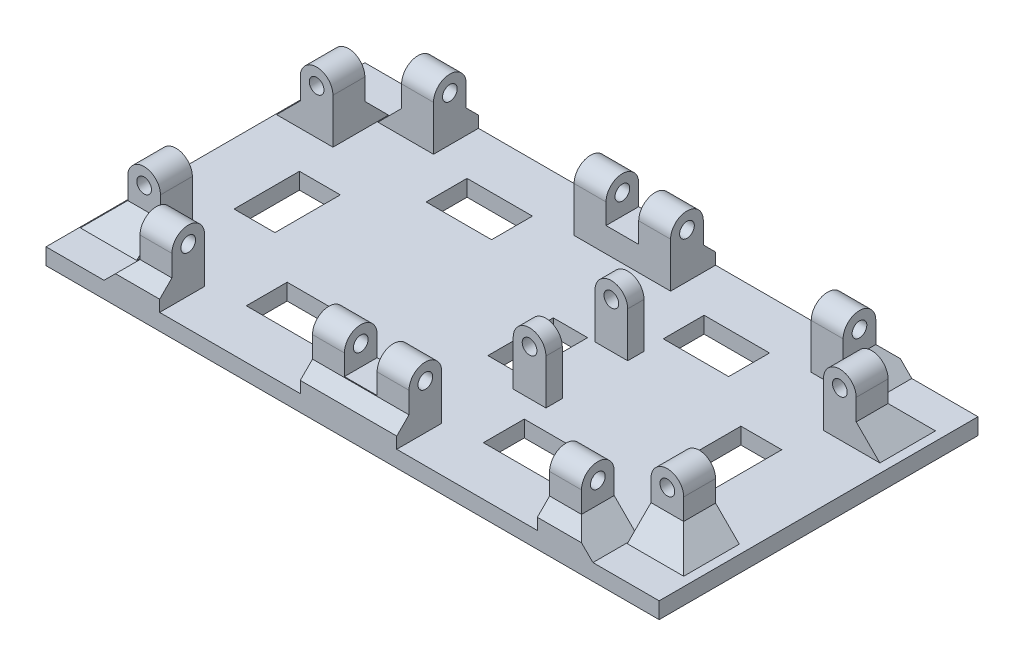
from build123d import *

# Parameters (mm, degrees)
SKETCH2_W                = 75
SKETCH2_H                = 39
BOSS_EXTRUDE1_DEPTH      = 2
BOSS_EXTRUDE2_START      = -10
SKETCH3_R                = 0.9
BOSS_EXTRUDE2_DEPTH      = 25
BOSS_EXTRUDE4_START      = -39
SKETCH3_2_R              = 0.9
BOSS_EXTRUDE4_DEPTH      = 25
BOSS_EXTRUDE5_DEPTH      = 12.5
BOSS_EXTRUDE5_DEPTH_BACK = 12.5
SKETCH7_R                = 0.9
SKETCH4_W                = 17.2
SKETCH4_H                = 7.5
CUT_EXTRUDE1_DEPTH       = 54.87717513
CUT_EXTRUDE2_REACH       = 44.927
SKETCH5_W                = 8
SKETCH5_H                = 5
SKETCH5_W_2              = 5
SKETCH5_H_2              = 8
SKETCH8_W                = 17.2
SKETCH8_H                = 7.5
CUT_EXTRUDE3_DEPTH       = 76.196409489
BOSS_EXTRUDE6_DEPTH      = 6
BOSS_EXTRUDE6_DEPTH_BACK = 6
SKETCH9_R                = 0.9
CUT_EXTRUDE4_REACH       = 54.355
SKETCH10_W               = 8
SKETCH10_H               = 7.5
CUT_EXTRUDE5_REACH       = 44.927
SKETCH11_W               = 4.2
SKETCH11_H               = 8
SKETCH12_W               = 4
SKETCH12_H               = 4
BOSS_EXTRUDE7_DEPTH      = 3
CHAMFER1_SIZE            = 2.9


with BuildPart() as part:
    # Sketch2 → Boss-Extrude1 (new body)
    with BuildSketch(Plane(origin=(0, 0, 0), x_dir=(1, 0, 0), z_dir=(0, 1, 0))):
        Rectangle(SKETCH2_W, SKETCH2_H)
    extrude(amount=BOSS_EXTRUDE1_DEPTH)

    # Sketch3 → Boss-Extrude2 (add)
    # profile 1 of 2: a face of its own
    with BuildSketch(Plane.ZY.offset(37.5).offset(BOSS_EXTRUDE2_START)):
        with BuildLine():
            Line((-18, 2), (-14, 2))
            Line((-14, 2), (-14, 7.5))
            ThreePointArc((-14, 7.5), (-16, 9.5), (-18, 7.5))
            Line((-18, 7.5), (-18, 2))
        make_face()
        with Locations((-16, 7.5)):
            Circle(SKETCH3_R, mode=Mode.SUBTRACT)
    # profile 2 of 2: a face of its own
    with BuildSketch(Plane.ZY.offset(37.5).offset(BOSS_EXTRUDE2_START)):
        with BuildLine():
            Line((18, 2), (18, 7.5))
            ThreePointArc((18, 7.5), (16, 9.5), (14, 7.5))
            Line((14, 7.5), (14, 2))
            Line((14, 2), (18, 2))
        make_face()
        with Locations((16, 7.5)):
            Circle(SKETCH3_R, mode=Mode.SUBTRACT)
    extrude(amount=-BOSS_EXTRUDE2_DEPTH)

    # Sketch3<2> → Boss-Extrude4 (add)
    # profile 1 of 2: a face of its own
    with BuildSketch(Plane.ZY.offset(37.5).offset(BOSS_EXTRUDE4_START)):
        with BuildLine():
            Line((-18, 2), (-14, 2))
            Line((-14, 2), (-14, 7.5))
            ThreePointArc((-14, 7.5), (-16, 9.5), (-18, 7.5))
            Line((-18, 7.5), (-18, 2))
        make_face()
        with Locations((-16, 7.5)):
            Circle(SKETCH3_2_R, mode=Mode.SUBTRACT)
    # profile 2 of 2: a face of its own
    with BuildSketch(Plane.ZY.offset(37.5).offset(BOSS_EXTRUDE4_START)):
        with BuildLine():
            Line((18, 2), (18, 7.5))
            ThreePointArc((18, 7.5), (16, 9.5), (14, 7.5))
            Line((14, 7.5), (14, 2))
            Line((14, 2), (18, 2))
        make_face()
        with Locations((16, 7.5)):
            Circle(SKETCH3_2_R, mode=Mode.SUBTRACT)
    extrude(amount=-BOSS_EXTRUDE4_DEPTH)

    # Sketch7 → Boss-Extrude5 (add, two sides: drawn at the far end of the back side and taken through both)
    # profile 1 of 2: a face of its own
    with BuildSketch(Plane.XY.offset(-BOSS_EXTRUDE5_DEPTH_BACK)):
        with BuildLine():
            Line((-34.5, 2), (-30.5, 2))
            Line((-30.5, 2), (-30.5, 7.5))
            ThreePointArc((-30.5, 7.5), (-32.5, 9.5), (-34.5, 7.5))
            Line((-34.5, 7.5), (-34.5, 2))
        make_face()
        with Locations((-32.5, 7.5)):
            Circle(SKETCH7_R, mode=Mode.SUBTRACT)
    # profile 2 of 2: a face of its own
    with BuildSketch(Plane.XY.offset(-BOSS_EXTRUDE5_DEPTH_BACK)):
        with BuildLine():
            Line((33.5, 2), (33.5, 7.5))
            ThreePointArc((33.5, 7.5), (31.5, 9.5), (29.5, 7.5))
            Line((29.5, 7.5), (29.5, 2))
            Line((29.5, 2), (33.5, 2))
        make_face()
        with Locations((31.5, 7.5)):
            Circle(SKETCH7_R, mode=Mode.SUBTRACT)
    extrude(amount=BOSS_EXTRUDE5_DEPTH + BOSS_EXTRUDE5_DEPTH_BACK)

    # Sketch4 → Cut-Extrude1 (cut, through all)
    with BuildSketch(Plane(origin=(0, 0, -18), x_dir=(-1, 0, 0), z_dir=(0, 0, -1))):
        with Locations((15, 5.75)):
            Rectangle(SKETCH4_W, SKETCH4_H)
        with Locations((-14, 5.75)):
            Rectangle(SKETCH4_W, SKETCH4_H)
    extrude(amount=-CUT_EXTRUDE1_DEPTH, mode=Mode.SUBTRACT)

    # Sketch5 → Cut-Extrude2 (cut, up to next)
    with BuildSketch(Plane(origin=(0, 2, 0), x_dir=(1, 0, 0), z_dir=(0, 1, 0)), mode=Mode.PRIVATE) as cut_extrude2_sk1:
        with Locations((-15, 11)):
            Rectangle(SKETCH5_W, SKETCH5_H)
    cut_extrude2_tool1 = extrude(cut_extrude2_sk1.sketch, amount=-CUT_EXTRUDE2_REACH, mode=Mode.PRIVATE) & part.part
    # Sketch5 → Cut-Extrude2 (cut, up to next)
    with BuildSketch(Plane(origin=(0, 2, 0), x_dir=(1, 0, 0), z_dir=(0, 1, 0)), mode=Mode.PRIVATE) as cut_extrude2_sk2:
        with Locations((14, 11)):
            Rectangle(SKETCH5_W, SKETCH5_H)
    cut_extrude2_tool2 = extrude(cut_extrude2_sk2.sketch, amount=-CUT_EXTRUDE2_REACH, mode=Mode.PRIVATE) & part.part
    # Sketch5 → Cut-Extrude2 (cut, up to next)
    with BuildSketch(Plane(origin=(0, 2, 0), x_dir=(1, 0, 0), z_dir=(0, 1, 0)), mode=Mode.PRIVATE) as cut_extrude2_sk3:
        with Locations((-15, -11)):
            Rectangle(SKETCH5_W, SKETCH5_H)
    cut_extrude2_tool3 = extrude(cut_extrude2_sk3.sketch, amount=-CUT_EXTRUDE2_REACH, mode=Mode.PRIVATE) & part.part
    # Sketch5 → Cut-Extrude2 (cut, up to next)
    with BuildSketch(Plane(origin=(0, 2, 0), x_dir=(1, 0, 0), z_dir=(0, 1, 0)), mode=Mode.PRIVATE) as cut_extrude2_sk4:
        with Locations((14, -11)):
            Rectangle(SKETCH5_W, SKETCH5_H)
    cut_extrude2_tool4 = extrude(cut_extrude2_sk4.sketch, amount=-CUT_EXTRUDE2_REACH, mode=Mode.PRIVATE) & part.part
    # Sketch5 → Cut-Extrude2 (cut, up to next)
    with BuildSketch(Plane(origin=(0, 2, 0), x_dir=(1, 0, 0), z_dir=(0, 1, 0)), mode=Mode.PRIVATE) as cut_extrude2_sk5:
        with Locations((26.5, 0)):
            Rectangle(SKETCH5_W_2, SKETCH5_H_2)
    cut_extrude2_tool5 = extrude(cut_extrude2_sk5.sketch, amount=-CUT_EXTRUDE2_REACH, mode=Mode.PRIVATE) & part.part
    # Sketch5 → Cut-Extrude2 (cut, up to next)
    with BuildSketch(Plane(origin=(0, 2, 0), x_dir=(1, 0, 0), z_dir=(0, 1, 0)), mode=Mode.PRIVATE) as cut_extrude2_sk6:
        with Locations((-27.5, 0)):
            Rectangle(SKETCH5_W_2, SKETCH5_H_2)
    cut_extrude2_tool6 = extrude(cut_extrude2_sk6.sketch, amount=-CUT_EXTRUDE2_REACH, mode=Mode.PRIVATE) & part.part
    add(cut_extrude2_tool1.solids().sort_by_distance((-15, 2, -11))[0], mode=Mode.SUBTRACT)
    add(cut_extrude2_tool2.solids().sort_by_distance((14, 2, -11))[0], mode=Mode.SUBTRACT)
    add(cut_extrude2_tool3.solids().sort_by_distance((-15, 2, 11))[0], mode=Mode.SUBTRACT)
    add(cut_extrude2_tool4.solids().sort_by_distance((14, 2, 11))[0], mode=Mode.SUBTRACT)
    add(cut_extrude2_tool5.solids().sort_by_distance((26.5, 2, 0))[0], mode=Mode.SUBTRACT)
    add(cut_extrude2_tool6.solids().sort_by_distance((-27.5, 2, 0))[0], mode=Mode.SUBTRACT)

    # Sketch8 → Cut-Extrude3 (cut, through all)
    with BuildSketch(Plane.ZY.offset(34.5)):
        with Locations((0, 5.75)):
            Rectangle(SKETCH8_W, SKETCH8_H)
    extrude(amount=-CUT_EXTRUDE3_DEPTH, mode=Mode.SUBTRACT)

    # Sketch9 → Boss-Extrude6 (add, two sides: drawn at the far end of the back side and taken through both)
    with BuildSketch(Plane.XY.offset(-BOSS_EXTRUDE6_DEPTH_BACK)):
        with BuildLine():
            Line((10.15, 2), (10.15, 7.5))
            ThreePointArc((10.15, 7.5), (8.15, 9.5), (6.15, 7.5))
            Line((6.15, 7.5), (6.15, 2))
            Line((6.15, 2), (10.15, 2))
        make_face()
        with Locations((8.15, 7.5)):
            Circle(SKETCH9_R, mode=Mode.SUBTRACT)
    extrude(amount=BOSS_EXTRUDE6_DEPTH + BOSS_EXTRUDE6_DEPTH_BACK)

    # Sketch10 → Cut-Extrude4 (cut, up to next)
    with BuildSketch(Plane(origin=(10.15, 0, 0), x_dir=(0, 0, -1), z_dir=(1, 0, 0)), mode=Mode.PRIVATE) as cut_extrude4_sk1:
        with Locations((0, 5.75)):
            Rectangle(SKETCH10_W, SKETCH10_H)
    cut_extrude4_tool1 = extrude(cut_extrude4_sk1.sketch, amount=-CUT_EXTRUDE4_REACH, mode=Mode.PRIVATE) & part.part
    add(cut_extrude4_tool1.solids().sort_by_distance((10.15, 5.75, 0))[0], mode=Mode.SUBTRACT)

    # Sketch11 → Cut-Extrude5 (cut, up to next)
    with BuildSketch(Plane(origin=(0, 2, 0), x_dir=(1, 0, 0), z_dir=(0, 1, 0)), mode=Mode.PRIVATE) as cut_extrude5_sk1:
        with Locations((3.15, 0)):
            Rectangle(SKETCH11_W, SKETCH11_H)
    cut_extrude5_tool1 = extrude(cut_extrude5_sk1.sketch, amount=-CUT_EXTRUDE5_REACH, mode=Mode.PRIVATE) & part.part
    add(cut_extrude5_tool1.solids().sort_by_distance((3.15, 2, 0))[0], mode=Mode.SUBTRACT)

    # Sketch12 → Boss-Extrude7 (add)
    with BuildSketch(Plane(origin=(0, 2, 0), x_dir=(1, 0, 0), z_dir=(0, 1, 0))):
        with Locations((-0.5, -16)):
            Rectangle(SKETCH12_W, SKETCH12_H)
        with Locations((-0.5, 16)):
            Rectangle(SKETCH12_W, SKETCH12_H)
    extrude(amount=BOSS_EXTRUDE7_DEPTH)

    # Chamfer1
    # the kernel refuses this chamfer: 2.9 mm, written as the material it adds along each edge
    with BuildSketch(Plane(origin=(-27.5, 2, 18), x_dir=(0, -0.027495876610586396, 0.9996219169112968), z_dir=(1, 0, 0))) as chamfer1_piece_1_section:
        Polygon((CHAMFER1_SIZE * 0.999621916911, -CHAMFER1_SIZE * 0.0274958766106), (-CHAMFER1_SIZE * 0.0274958766106, -CHAMFER1_SIZE * 0.999621916911), (0, 0), align=None)
    chamfer1_piece_1 = extrude(amount=3.9, mode=Mode.PRIVATE)
    chamfer1_piece_1 = split(chamfer1_piece_1, bisect_by=Plane(origin=(-25.55, 3.131220623, 19.5), z_dir=(0, 0, -1)), keep=Keep.TOP, mode=Mode.PRIVATE)
    add(chamfer1_piece_1)
    with BuildSketch(Plane(origin=(-27.5, 2, -18), x_dir=(0, -0.027495876610586546, -0.9996219169112968), z_dir=(1, 0, 0))) as chamfer1_piece_2_section:
        Polygon((CHAMFER1_SIZE * 0.999621916911, CHAMFER1_SIZE * 0.0274958766106), (-CHAMFER1_SIZE * 0.0274958766106, CHAMFER1_SIZE * 0.999621916911), (0, 0), align=None)
    chamfer1_piece_2 = extrude(amount=3.9, mode=Mode.PRIVATE)
    chamfer1_piece_2 = split(chamfer1_piece_2, bisect_by=Plane(origin=(-25.55, 3.131220623, -19.5), z_dir=(0, 0, 1)), keep=Keep.TOP, mode=Mode.PRIVATE)
    add(chamfer1_piece_2)
    with BuildSketch(Plane(origin=(-6.4, 2, -18), x_dir=(0, -0.02749587661058513, -0.9996219169112968), z_dir=(1, 0, 0))) as chamfer1_piece_3_section:
        Polygon((CHAMFER1_SIZE * 0.999621916911, CHAMFER1_SIZE * 0.0274958766106), (-CHAMFER1_SIZE * 0.0274958766106, CHAMFER1_SIZE * 0.999621916911), (0, 0), align=None)
    chamfer1_piece_3 = extrude(amount=11.8, mode=Mode.PRIVATE)
    chamfer1_piece_3 = split(chamfer1_piece_3, bisect_by=Plane(origin=(-0.5, 3.131220623, -19.5), z_dir=(0, 0, 1)), keep=Keep.TOP, mode=Mode.PRIVATE)
    add(chamfer1_piece_3)
    with BuildSketch(Plane(origin=(-27.5, 2, -18), x_dir=(-0.9996219169112968, -0.027495876610586546, 0), z_dir=(0, 0, 1)), Plane(origin=(-27.5, 2, 14), x_dir=(-0.9996219169112968, -0.027495876610586396, 0), z_dir=(0, 0, 1)), Plane(origin=(-34.5, 2, 12.5), x_dir=(0, -0.02749587661058638, 0.9996219169112968), z_dir=(1, 0, 0)), Plane(origin=(29.5, 2, 12.5), x_dir=(0, -0.02749587661058638, 0.9996219169112968), z_dir=(1, 0, 0))) as chamfer1_piece_4:
        Polygon((CHAMFER1_SIZE * 0.999621916911, -CHAMFER1_SIZE * 0.0274958766106), (-CHAMFER1_SIZE * 0.0274958766106, -CHAMFER1_SIZE * 0.999621916911), (0, 0), align=None)
    extrude(amount=4)
    with BuildSketch(Plane(origin=(33.5, 2, 8.6), x_dir=(0.9996219169112968, -0.027495876610586396, 0), z_dir=(0, 0, 1)), Plane(origin=(33.5, 2, -12.5), x_dir=(0.9996219169112968, -0.027495876610586396, 0), z_dir=(0, 0, 1))) as chamfer1_piece_5:
        Polygon((CHAMFER1_SIZE * 0.999621916911, CHAMFER1_SIZE * 0.0274958766106), (-CHAMFER1_SIZE * 0.0274958766106, CHAMFER1_SIZE * 0.999621916911), (0, 0), align=None)
    extrude(amount=3.9)
    with BuildSketch(Plane(origin=(5.4, 2, 18), x_dir=(0, -0.027495876610586396, 0.9996219169112968), z_dir=(-1, 0, 0))) as chamfer1_piece_6_section:
        Polygon((CHAMFER1_SIZE * 0.999621916911, CHAMFER1_SIZE * 0.0274958766106), (-CHAMFER1_SIZE * 0.0274958766106, CHAMFER1_SIZE * 0.999621916911), (0, 0), align=None)
    chamfer1_piece_6 = extrude(amount=11.8, mode=Mode.PRIVATE)
    chamfer1_piece_6 = split(chamfer1_piece_6, bisect_by=Plane(origin=(-0.5, 3.131220623, 19.5), z_dir=(0, 0, -1)), keep=Keep.TOP, mode=Mode.PRIVATE)
    add(chamfer1_piece_6)
    with BuildSketch(Plane(origin=(-34.5, 2, 8.6), x_dir=(-0.9996219169112968, -0.027495876610586396, 0), z_dir=(0, 0, 1)), Plane(origin=(-34.5, 2, -12.5), x_dir=(-0.9996219169112968, -0.027495876610586396, 0), z_dir=(0, 0, 1))) as chamfer1_piece_7:
        Polygon((CHAMFER1_SIZE * 0.999621916911, -CHAMFER1_SIZE * 0.0274958766106), (-CHAMFER1_SIZE * 0.0274958766106, -CHAMFER1_SIZE * 0.999621916911), (0, 0), align=None)
    extrude(amount=3.9)
    with BuildSketch(Plane(origin=(22.6, 2, -18), x_dir=(0, -0.027495876610586546, -0.9996219169112968), z_dir=(1, 0, 0))) as chamfer1_piece_8_section:
        Polygon((CHAMFER1_SIZE * 0.999621916911, CHAMFER1_SIZE * 0.0274958766106), (-CHAMFER1_SIZE * 0.0274958766106, CHAMFER1_SIZE * 0.999621916911), (0, 0), align=None)
    chamfer1_piece_8 = extrude(amount=3.9, mode=Mode.PRIVATE)
    chamfer1_piece_8 = split(chamfer1_piece_8, bisect_by=Plane(origin=(24.55, 3.131220623, -19.5), z_dir=(0, 0, 1)), keep=Keep.TOP, mode=Mode.PRIVATE)
    add(chamfer1_piece_8)
    with BuildSketch(Plane(origin=(26.5, 2, -18), x_dir=(0.9996219169112968, -0.027495876610586546, 0), z_dir=(0, 0, 1)), Plane(origin=(26.5, 2, 14), x_dir=(0.9996219169112968, -0.027495876610586396, 0), z_dir=(0, 0, 1)), Plane(origin=(-34.5, 2, -12.5), x_dir=(0, -0.02749587661058638, -0.9996219169112968), z_dir=(1, 0, 0)), Plane(origin=(29.5, 2, -12.5), x_dir=(0, -0.02749587661058638, -0.9996219169112968), z_dir=(1, 0, 0))) as chamfer1_piece_9:
        Polygon((CHAMFER1_SIZE * 0.999621916911, CHAMFER1_SIZE * 0.0274958766106), (-CHAMFER1_SIZE * 0.0274958766106, CHAMFER1_SIZE * 0.999621916911), (0, 0), align=None)
    extrude(amount=4)
    with BuildSketch(Plane(origin=(22.6, 2, 18), x_dir=(0, -0.027495876610586396, 0.9996219169112968), z_dir=(1, 0, 0))) as chamfer1_piece_10_section:
        Polygon((CHAMFER1_SIZE * 0.999621916911, -CHAMFER1_SIZE * 0.0274958766106), (-CHAMFER1_SIZE * 0.0274958766106, -CHAMFER1_SIZE * 0.999621916911), (0, 0), align=None)
    chamfer1_piece_10 = extrude(amount=3.9, mode=Mode.PRIVATE)
    chamfer1_piece_10 = split(chamfer1_piece_10, bisect_by=Plane(origin=(24.55, 3.131220623, 19.5), z_dir=(0, 0, -1)), keep=Keep.TOP, mode=Mode.PRIVATE)
    add(chamfer1_piece_10)
    with BuildSketch(Plane(origin=(-34.957880665, 2, 18), x_dir=(0, -0.027495876610586396, 0.9996219169112968), z_dir=(1, 0, 0))) as chamfer1_piece_11a_section:
        Polygon((CHAMFER1_SIZE * 0.999621916911, -CHAMFER1_SIZE * 0.0274958766106), (-CHAMFER1_SIZE * 0.0274958766106, -CHAMFER1_SIZE * 0.999621916911), (0, 0), align=None)
    chamfer1_piece_11a = extrude(amount=11.357880665, mode=Mode.PRIVATE)
    chamfer1_piece_11a = split(chamfer1_piece_11a, bisect_by=Plane(origin=(-31.228940333, 3.131220623, 19.5), z_dir=(0, 0, -1)), keep=Keep.TOP, mode=Mode.PRIVATE)
    chamfer1_piece_11a = split(chamfer1_piece_11a, bisect_by=Plane(origin=(-27.5, 3.131220623, 18.622253748), z_dir=(-1, 0, 0)), keep=Keep.TOP, mode=Mode.PRIVATE)
    with BuildSketch(Plane(origin=(-27.5, 2, 14), x_dir=(-0.9996219169112968, -0.027495876610586396, 0), z_dir=(0, 0, 1))) as chamfer1_piece_11b_section:
        Polygon((CHAMFER1_SIZE * 0.999621916911, -CHAMFER1_SIZE * 0.0274958766106), (-CHAMFER1_SIZE * 0.0274958766106, -CHAMFER1_SIZE * 0.999621916911), (0, 0), align=None)
    chamfer1_piece_11b = extrude(amount=11.457880665, mode=Mode.PRIVATE)
    chamfer1_piece_11b = split(chamfer1_piece_11b, bisect_by=Plane(origin=(-28.456401518, 2.956401518, 19.5), z_dir=(0, 0, -1)), keep=Keep.TOP, mode=Mode.PRIVATE)
    chamfer1_piece_11b = split(chamfer1_piece_11b, bisect_by=Plane(origin=(-28.456401518, 2.956401518, 18), z_dir=(0, 0, 1)), keep=Keep.TOP, mode=Mode.PRIVATE)
    chamfer1_piece_11 = chamfer1_piece_11a & chamfer1_piece_11b
    add(chamfer1_piece_11)
    with BuildSketch(Plane(origin=(-34.957880665, 2, -18), x_dir=(0, -0.027495876610586396, -0.9996219169112968), z_dir=(1, 0, 0))) as chamfer1_piece_12a_section:
        Polygon((CHAMFER1_SIZE * 0.999621916911, CHAMFER1_SIZE * 0.0274958766106), (-CHAMFER1_SIZE * 0.0274958766106, CHAMFER1_SIZE * 0.999621916911), (0, 0), align=None)
    chamfer1_piece_12a = extrude(amount=11.357880665, mode=Mode.PRIVATE)
    chamfer1_piece_12a = split(chamfer1_piece_12a, bisect_by=Plane(origin=(-31.228940333, 3.131220623, -19.5), z_dir=(0, 0, 1)), keep=Keep.TOP, mode=Mode.PRIVATE)
    chamfer1_piece_12a = split(chamfer1_piece_12a, bisect_by=Plane(origin=(-27.5, 3.131220623, -18.622253748), z_dir=(-1, 0, 0)), keep=Keep.TOP, mode=Mode.PRIVATE)
    with BuildSketch(Plane(origin=(-27.5, 2, -25.457880665), x_dir=(-0.9996219169112968, -0.027495876610586396, 0), z_dir=(0, 0, 1))) as chamfer1_piece_12b_section:
        Polygon((CHAMFER1_SIZE * 0.999621916911, -CHAMFER1_SIZE * 0.0274958766106), (-CHAMFER1_SIZE * 0.0274958766106, -CHAMFER1_SIZE * 0.999621916911), (0, 0), align=None)
    chamfer1_piece_12b = extrude(amount=11.457880665, mode=Mode.PRIVATE)
    chamfer1_piece_12b = split(chamfer1_piece_12b, bisect_by=Plane(origin=(-28.456401518, 2.956401518, -19.5), z_dir=(0, 0, 1)), keep=Keep.TOP, mode=Mode.PRIVATE)
    chamfer1_piece_12b = split(chamfer1_piece_12b, bisect_by=Plane(origin=(-28.456401518, 2.956401518, -18), z_dir=(0, 0, -1)), keep=Keep.TOP, mode=Mode.PRIVATE)
    chamfer1_piece_12 = chamfer1_piece_12a & chamfer1_piece_12b
    add(chamfer1_piece_12)
    with BuildSketch(Plane(origin=(33.5, 2, 8.6), x_dir=(0.9996219169112968, -0.027495876610586396, 0), z_dir=(0, 0, 1))) as chamfer1_piece_13a_section:
        Polygon((CHAMFER1_SIZE * 0.999621916911, CHAMFER1_SIZE * 0.0274958766106), (-CHAMFER1_SIZE * 0.0274958766106, CHAMFER1_SIZE * 0.999621916911), (0, 0), align=None)
    chamfer1_piece_13a = extrude(amount=11.357880665, mode=Mode.PRIVATE)
    chamfer1_piece_13a = split(chamfer1_piece_13a, bisect_by=Plane(origin=(34.456401518, 2.956401518, 19.5), z_dir=(0, 0, -1)), keep=Keep.TOP, mode=Mode.PRIVATE)
    chamfer1_piece_13a = split(chamfer1_piece_13a, bisect_by=Plane(origin=(34.456401518, 2.956401518, 12.5), z_dir=(0, 0, 1)), keep=Keep.TOP, mode=Mode.PRIVATE)
    with BuildSketch(Plane(origin=(29.5, 2, 12.5), x_dir=(0, -0.02749587661058638, 0.9996219169112968), z_dir=(1, 0, 0))) as chamfer1_piece_13b_section:
        Polygon((CHAMFER1_SIZE * 0.999621916911, -CHAMFER1_SIZE * 0.0274958766106), (-CHAMFER1_SIZE * 0.0274958766106, -CHAMFER1_SIZE * 0.999621916911), (0, 0), align=None)
    chamfer1_piece_13b = extrude(amount=11.457880665, mode=Mode.PRIVATE)
    chamfer1_piece_13b = split(chamfer1_piece_13b, bisect_by=Plane(origin=(37.5, 2.956401518, 13.456401518), z_dir=(-1, 0, 0)), keep=Keep.TOP, mode=Mode.PRIVATE)
    chamfer1_piece_13b = split(chamfer1_piece_13b, bisect_by=Plane(origin=(33.5, 2.956401518, 13.456401518), z_dir=(1, 0, 0)), keep=Keep.TOP, mode=Mode.PRIVATE)
    chamfer1_piece_13 = chamfer1_piece_13a & chamfer1_piece_13b
    add(chamfer1_piece_13)
    with BuildSketch(Plane(origin=(-34.5, 2, 8.6), x_dir=(-0.9996219169112968, -0.027495876610586396, 0), z_dir=(0, 0, 1))) as chamfer1_piece_14a_section:
        Polygon((CHAMFER1_SIZE * 0.999621916911, -CHAMFER1_SIZE * 0.0274958766106), (-CHAMFER1_SIZE * 0.0274958766106, -CHAMFER1_SIZE * 0.999621916911), (0, 0), align=None)
    chamfer1_piece_14a = extrude(amount=11.357880665, mode=Mode.PRIVATE)
    chamfer1_piece_14a = split(chamfer1_piece_14a, bisect_by=Plane(origin=(-35.456401518, 2.956401518, 19.5), z_dir=(0, 0, -1)), keep=Keep.TOP, mode=Mode.PRIVATE)
    chamfer1_piece_14a = split(chamfer1_piece_14a, bisect_by=Plane(origin=(-35.456401518, 2.956401518, 12.5), z_dir=(0, 0, 1)), keep=Keep.TOP, mode=Mode.PRIVATE)
    with BuildSketch(Plane(origin=(-41.957880665, 2, 12.5), x_dir=(0, -0.02749587661058638, 0.9996219169112968), z_dir=(1, 0, 0))) as chamfer1_piece_14b_section:
        Polygon((CHAMFER1_SIZE * 0.999621916911, -CHAMFER1_SIZE * 0.0274958766106), (-CHAMFER1_SIZE * 0.0274958766106, -CHAMFER1_SIZE * 0.999621916911), (0, 0), align=None)
    chamfer1_piece_14b = extrude(amount=11.457880665, mode=Mode.PRIVATE)
    chamfer1_piece_14b = split(chamfer1_piece_14b, bisect_by=Plane(origin=(-37.5, 2.956401518, 13.456401518), z_dir=(1, 0, 0)), keep=Keep.TOP, mode=Mode.PRIVATE)
    chamfer1_piece_14b = split(chamfer1_piece_14b, bisect_by=Plane(origin=(-34.5, 2.956401518, 13.456401518), z_dir=(-1, 0, 0)), keep=Keep.TOP, mode=Mode.PRIVATE)
    chamfer1_piece_14 = chamfer1_piece_14a & chamfer1_piece_14b
    add(chamfer1_piece_14)
    with BuildSketch(Plane(origin=(22.6, 2, -18), x_dir=(0, -0.027495876610586546, -0.9996219169112968), z_dir=(1, 0, 0))) as chamfer1_piece_15a_section:
        Polygon((CHAMFER1_SIZE * 0.999621916911, CHAMFER1_SIZE * 0.0274958766106), (-CHAMFER1_SIZE * 0.0274958766106, CHAMFER1_SIZE * 0.999621916911), (0, 0), align=None)
    chamfer1_piece_15a = extrude(amount=11.357880665, mode=Mode.PRIVATE)
    chamfer1_piece_15a = split(chamfer1_piece_15a, bisect_by=Plane(origin=(30.228940333, 3.131220623, -19.5), z_dir=(0, 0, 1)), keep=Keep.TOP, mode=Mode.PRIVATE)
    chamfer1_piece_15a = split(chamfer1_piece_15a, bisect_by=Plane(origin=(26.5, 3.131220623, -18.622253748), z_dir=(1, 0, 0)), keep=Keep.TOP, mode=Mode.PRIVATE)
    with BuildSketch(Plane(origin=(26.5, 2, -25.457880665), x_dir=(0.9996219169112968, -0.027495876610586396, 0), z_dir=(0, 0, 1))) as chamfer1_piece_15b_section:
        Polygon((CHAMFER1_SIZE * 0.999621916911, CHAMFER1_SIZE * 0.0274958766106), (-CHAMFER1_SIZE * 0.0274958766106, CHAMFER1_SIZE * 0.999621916911), (0, 0), align=None)
    chamfer1_piece_15b = extrude(amount=11.457880665, mode=Mode.PRIVATE)
    chamfer1_piece_15b = split(chamfer1_piece_15b, bisect_by=Plane(origin=(27.456401518, 2.956401518, -19.5), z_dir=(0, 0, 1)), keep=Keep.TOP, mode=Mode.PRIVATE)
    chamfer1_piece_15b = split(chamfer1_piece_15b, bisect_by=Plane(origin=(27.456401518, 2.956401518, -18), z_dir=(0, 0, -1)), keep=Keep.TOP, mode=Mode.PRIVATE)
    chamfer1_piece_15 = chamfer1_piece_15a & chamfer1_piece_15b
    add(chamfer1_piece_15)
    with BuildSketch(Plane(origin=(22.6, 2, 18), x_dir=(0, -0.027495876610586396, 0.9996219169112968), z_dir=(1, 0, 0))) as chamfer1_piece_16a_section:
        Polygon((CHAMFER1_SIZE * 0.999621916911, -CHAMFER1_SIZE * 0.0274958766106), (-CHAMFER1_SIZE * 0.0274958766106, -CHAMFER1_SIZE * 0.999621916911), (0, 0), align=None)
    chamfer1_piece_16a = extrude(amount=11.357880665, mode=Mode.PRIVATE)
    chamfer1_piece_16a = split(chamfer1_piece_16a, bisect_by=Plane(origin=(30.228940333, 3.131220623, 19.5), z_dir=(0, 0, -1)), keep=Keep.TOP, mode=Mode.PRIVATE)
    chamfer1_piece_16a = split(chamfer1_piece_16a, bisect_by=Plane(origin=(26.5, 3.131220623, 18.622253748), z_dir=(1, 0, 0)), keep=Keep.TOP, mode=Mode.PRIVATE)
    with BuildSketch(Plane(origin=(26.5, 2, 14), x_dir=(0.9996219169112968, -0.027495876610586396, 0), z_dir=(0, 0, 1))) as chamfer1_piece_16b_section:
        Polygon((CHAMFER1_SIZE * 0.999621916911, CHAMFER1_SIZE * 0.0274958766106), (-CHAMFER1_SIZE * 0.0274958766106, CHAMFER1_SIZE * 0.999621916911), (0, 0), align=None)
    chamfer1_piece_16b = extrude(amount=11.457880665, mode=Mode.PRIVATE)
    chamfer1_piece_16b = split(chamfer1_piece_16b, bisect_by=Plane(origin=(27.456401518, 2.956401518, 19.5), z_dir=(0, 0, -1)), keep=Keep.TOP, mode=Mode.PRIVATE)
    chamfer1_piece_16b = split(chamfer1_piece_16b, bisect_by=Plane(origin=(27.456401518, 2.956401518, 18), z_dir=(0, 0, 1)), keep=Keep.TOP, mode=Mode.PRIVATE)
    chamfer1_piece_16 = chamfer1_piece_16a & chamfer1_piece_16b
    add(chamfer1_piece_16)
    with BuildSketch(Plane(origin=(-34.5, 2, -19.957880665), x_dir=(-0.9996219169112968, -0.027495876610586396, 0), z_dir=(0, 0, 1))) as chamfer1_piece_17a_section:
        Polygon((CHAMFER1_SIZE * 0.999621916911, -CHAMFER1_SIZE * 0.0274958766106), (-CHAMFER1_SIZE * 0.0274958766106, -CHAMFER1_SIZE * 0.999621916911), (0, 0), align=None)
    chamfer1_piece_17a = extrude(amount=11.357880665, mode=Mode.PRIVATE)
    chamfer1_piece_17a = split(chamfer1_piece_17a, bisect_by=Plane(origin=(-35.456401518, 2.956401518, -19.5), z_dir=(0, 0, 1)), keep=Keep.TOP, mode=Mode.PRIVATE)
    chamfer1_piece_17a = split(chamfer1_piece_17a, bisect_by=Plane(origin=(-35.456401518, 2.956401518, -12.5), z_dir=(0, 0, -1)), keep=Keep.TOP, mode=Mode.PRIVATE)
    with BuildSketch(Plane(origin=(-41.957880665, 2, -12.5), x_dir=(0, -0.02749587661058638, -0.9996219169112968), z_dir=(1, 0, 0))) as chamfer1_piece_17b_section:
        Polygon((CHAMFER1_SIZE * 0.999621916911, CHAMFER1_SIZE * 0.0274958766106), (-CHAMFER1_SIZE * 0.0274958766106, CHAMFER1_SIZE * 0.999621916911), (0, 0), align=None)
    chamfer1_piece_17b = extrude(amount=11.457880665, mode=Mode.PRIVATE)
    chamfer1_piece_17b = split(chamfer1_piece_17b, bisect_by=Plane(origin=(-37.5, 2.956401518, -13.456401518), z_dir=(1, 0, 0)), keep=Keep.TOP, mode=Mode.PRIVATE)
    chamfer1_piece_17b = split(chamfer1_piece_17b, bisect_by=Plane(origin=(-34.5, 2.956401518, -13.456401518), z_dir=(-1, 0, 0)), keep=Keep.TOP, mode=Mode.PRIVATE)
    chamfer1_piece_17 = chamfer1_piece_17a & chamfer1_piece_17b
    add(chamfer1_piece_17)
    with BuildSketch(Plane(origin=(33.5, 2, -19.957880665), x_dir=(0.9996219169112968, -0.027495876610586396, 0), z_dir=(0, 0, 1))) as chamfer1_piece_18a_section:
        Polygon((CHAMFER1_SIZE * 0.999621916911, CHAMFER1_SIZE * 0.0274958766106), (-CHAMFER1_SIZE * 0.0274958766106, CHAMFER1_SIZE * 0.999621916911), (0, 0), align=None)
    chamfer1_piece_18a = extrude(amount=11.357880665, mode=Mode.PRIVATE)
    chamfer1_piece_18a = split(chamfer1_piece_18a, bisect_by=Plane(origin=(34.456401518, 2.956401518, -19.5), z_dir=(0, 0, 1)), keep=Keep.TOP, mode=Mode.PRIVATE)
    chamfer1_piece_18a = split(chamfer1_piece_18a, bisect_by=Plane(origin=(34.456401518, 2.956401518, -12.5), z_dir=(0, 0, -1)), keep=Keep.TOP, mode=Mode.PRIVATE)
    with BuildSketch(Plane(origin=(29.5, 2, -12.5), x_dir=(0, -0.02749587661058638, -0.9996219169112968), z_dir=(1, 0, 0))) as chamfer1_piece_18b_section:
        Polygon((CHAMFER1_SIZE * 0.999621916911, CHAMFER1_SIZE * 0.0274958766106), (-CHAMFER1_SIZE * 0.0274958766106, CHAMFER1_SIZE * 0.999621916911), (0, 0), align=None)
    chamfer1_piece_18b = extrude(amount=11.457880665, mode=Mode.PRIVATE)
    chamfer1_piece_18b = split(chamfer1_piece_18b, bisect_by=Plane(origin=(37.5, 2.956401518, -13.456401518), z_dir=(-1, 0, 0)), keep=Keep.TOP, mode=Mode.PRIVATE)
    chamfer1_piece_18b = split(chamfer1_piece_18b, bisect_by=Plane(origin=(33.5, 2.956401518, -13.456401518), z_dir=(1, 0, 0)), keep=Keep.TOP, mode=Mode.PRIVATE)
    chamfer1_piece_18 = chamfer1_piece_18a & chamfer1_piece_18b
    add(chamfer1_piece_18)


solid = part.part
